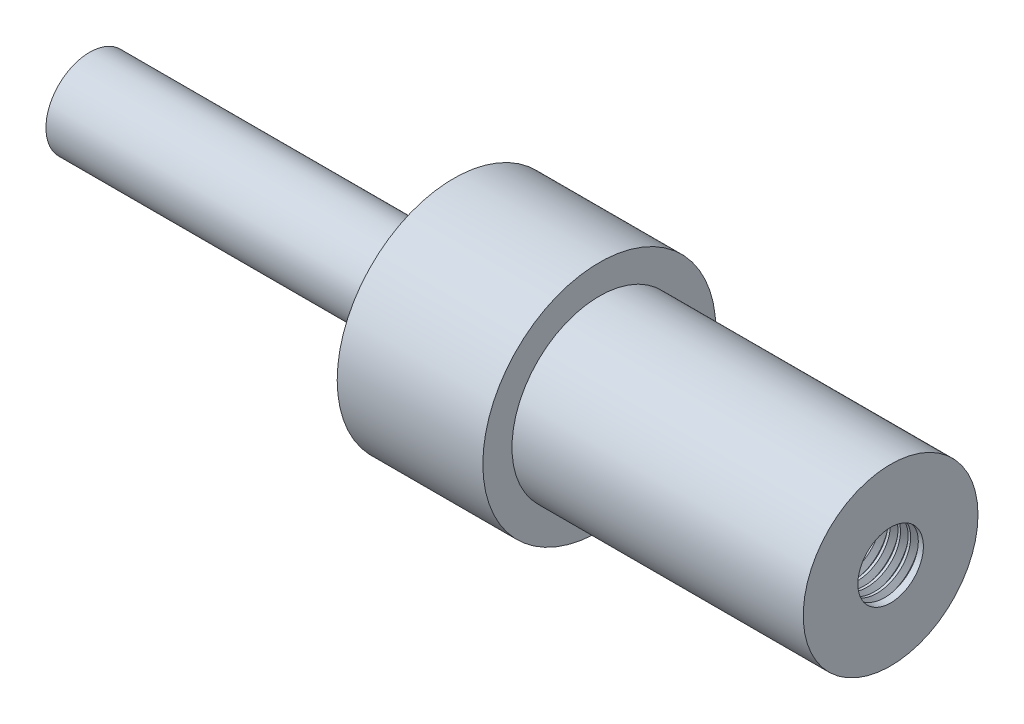
from build123d import *

# Parameters (mm, degrees)
M4_CLEARANCE_HOLE1_D     = 4.5
M4_CLEARANCE_HOLE1_DEPTH = 10
M4_CLEARANCE_HOLE1_TIP   = 1.351936393
THREAD1_PITCH            = 0.7


with BuildPart() as part:
    # Sketch1 → Revolve1 (revolve)
    with BuildSketch(Plane.XY, mode=Mode.PRIVATE) as revolve1_sk:
        Polygon((0, 0), (0, 3), (25, 3), (25, 8), (35, 8), (35, 6), (55, 6), (55, 0), align=None)
    revolve(revolve1_sk.sketch.rotate(Axis((55, 0, 0), (-1, 0, 0)), 90), axis=Axis((55, 0, 0), (-1, 0, 0)))

    # M4 Clearance Hole1
    with Locations(Plane(origin=(55, 0, 0), x_dir=(0, 0, -1), z_dir=(1, 0, 0))):
        with Locations((0, 0)):
            Hole(M4_CLEARANCE_HOLE1_D / 2, depth=M4_CLEARANCE_HOLE1_DEPTH)
            with Locations((0, 0, -(M4_CLEARANCE_HOLE1_DEPTH + M4_CLEARANCE_HOLE1_TIP / 2))):  # 118° drill point
                Cone(0, M4_CLEARANCE_HOLE1_D / 2, M4_CLEARANCE_HOLE1_TIP, mode=Mode.SUBTRACT)

    # Thread1: the profile of Thread Profile1 profile screwed along a right-hand helix of 14.285714 turns, 6 arcs to a turn; built about Z, then put on its axis
    thread1_z = Axis((0, 0, 0), (0, 0, 1))
    thread1_corners = [(2.2497, 0, -0.000173205), (2.628886112, 0, 0.218749999), (2.628886112, 0, 0.306249999), (2.2497, 0, 0.525173203)]
    with BuildLine(mode=Mode.PRIVATE) as thread1_profile:
        Line(thread1_corners[0], thread1_corners[1])
        Line(thread1_corners[1], thread1_corners[2])
        Line(thread1_corners[2], thread1_corners[3])
        Line(thread1_corners[3], thread1_corners[0])
    thread1_cap = Face(thread1_profile.wire())
    thread1_turn_angles = [0, 30, 60, 90, 120, 150, 180, 210, 240, 270, 300, 330, 360]
    thread1_turn_weights = [1, 0.8660254037844387, 1, 0.8660254037844387, 1, 0.8660254037844387, 1, 0.8660254037844387, 1, 0.8660254037844387, 1, 0.8660254037844387, 1]
    thread1_turn_rails = [Edge.make_bspline([Vector(p[0], p[1], 0).rotate(thread1_z, thread1_turn_angles[k]) / thread1_turn_weights[k] + Vector(0, 0, p[2] + THREAD1_PITCH * thread1_turn_angles[k] / 360) for k in range(13)], [0, 0, 0, 1, 1, 2, 2, 3, 3, 4, 4, 5, 5, 6, 6, 6], 2, thread1_turn_weights) for p in thread1_corners]
    thread1_turn_sides = [Face.make_surface_from_curves(thread1_turn_rails[p[0]], thread1_turn_rails[p[1]]) for p in [(0, 1), (1, 2), (2, 3), (3, 0)]]
    thread1_last_angles = [5040, 5070, 5100, 5121.428571429, 5142.857142857]
    thread1_last_weights = [1, 0.8660254037844387, 1, 0.9308737486442035, 1]
    thread1_last_rails = [Edge.make_bspline([Vector(p[0], p[1], 0).rotate(thread1_z, thread1_last_angles[k]) / thread1_last_weights[k] + Vector(0, 0, p[2] + THREAD1_PITCH * thread1_last_angles[k] / 360) for k in range(5)], [0, 0, 0, 1, 1, 2, 2, 2], 2, thread1_last_weights) for p in thread1_corners]
    thread1_last_sides = [Face.make_surface_from_curves(thread1_last_rails[p[0]], thread1_last_rails[p[1]]) for p in [(0, 1), (1, 2), (2, 3), (3, 0)]]
    thread1 = Plane(origin=(55, 0, 0), x_dir=(0, 0, 1), z_dir=(-1, 0, 0)) * Solid(Shell([*[p.moved(Location((0, 0, THREAD1_PITCH * i))) for i in range(14) for p in thread1_turn_sides], *thread1_last_sides, thread1_cap, thread1_cap.rotate(thread1_z, 5142.857142857).moved(Location((0, 0, THREAD1_PITCH * 5142.857142857 / 360)))]))
    add(thread1, mode=Mode.SUBTRACT)


solid = part.part
